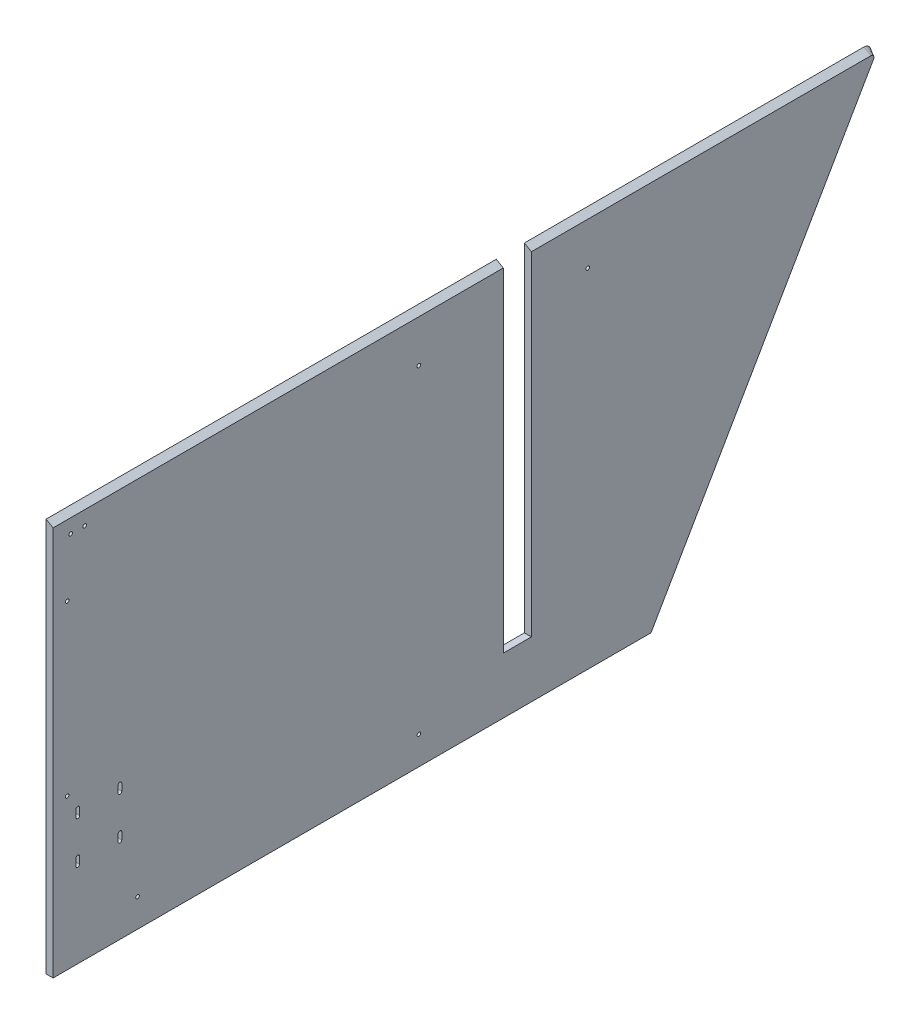
from build123d import *
from OCP.BRepFilletAPI import BRepFilletAPI_MakeChamfer

# Parameters (mm, degrees)
BOSS_EXTRUDE1_DEPTH                            = 6.35
SKETCH2_W                                      = 25.4
SKETCH2_H                                      = 304.8
CUT_EXTRUDE1_DEPTH                             = 672.86027017
FILLET1_R                                      = 6.35
CHAMFER3_SIZE                                  = 3.666174209
CHAMFER3_SIZE_2                                = 6.35
CSK_FOR_4_FLAT_HEAD_MACHINE_SCREW1_D           = 3.2639
CSK_FOR_4_FLAT_HEAD_MACHINE_SCREW1_CSINK_D     = 5.715
CSK_FOR_4_FLAT_HEAD_MACHINE_SCREW1_CSINK_ANGLE = 82
CUT_EXTRUDE2_REACH                             = 669.791
CSK_FOR_4_FLAT_HEAD_MACHINE_SCREW2_D           = 3.2639
CSK_FOR_4_FLAT_HEAD_MACHINE_SCREW2_CSINK_D     = 5.715
CSK_FOR_4_FLAT_HEAD_MACHINE_SCREW2_CSINK_ANGLE = 82


with BuildPart() as part:
    # Sketch1 → Boss-Extrude1 (new body)
    with BuildSketch(Plane(origin=(0, 0, 0), x_dir=(0, 0, -1), z_dir=(1, 0, 0))):
        Polygon((588.635764647, 323.826862244), (383.330008924, -31.773137756), (-160.664235353, -31.773137756), (-160.664235353, 323.826862244), align=None)
    extrude(amount=BOSS_EXTRUDE1_DEPTH)

    # Sketch2 → Cut-Extrude1 (cut, through all)
    with BuildSketch(Plane.ZY):
        with Locations((-258.435764647, 171.426862244)):
            Rectangle(SKETCH2_W, SKETCH2_H)
    extrude(amount=-CUT_EXTRUDE1_DEPTH, mode=Mode.SUBTRACT)

    # Fillet1
    fillet1_edges = [part.edges().sort_by_distance(p)[0] for p in [
        (3.175, 323.826862244, -588.635764647),
    ]]
    fillet(fillet1_edges, radius=FILLET1_R)

    # Chamfer3
    chamfer3_edges_1 = [part.edges().sort_by_distance(p)[0] for p in [
        (6.35, 323.826862244, -42.535764647),
    ]]
    chamfer3_side_1 = [part.faces().sort_by_distance(p)[0] for p in [
        (6.35, 323.753538759, -42.535764647),
    ]]
    chamfer3_edges_2 = [part.edges().sort_by_distance(p)[0] for p in [
        (6.35, 141.264362244, -483.233256128),
    ]]
    chamfer3_side_2 = [part.faces().sort_by_distance(p)[0] for p in [
        (6.276676516, 141.264362244, -483.233256128),
    ]]
    chamfer3_edges_3 = [part.edges().sort_by_distance(p)[0] for p in [
        (6.35, 320.651862244, -583.136503333),
    ]]
    chamfer3_side_3 = [part.faces().sort_by_distance(p)[0] for p in [
        (6.276676516, 320.651862244, -583.136503333),
    ]]
    chamfer3_edges_4 = [part.edges().sort_by_distance(p)[0] for p in [
        (6.35, 323.826862244, -424.386503333),
    ]]
    chamfer3_side_4 = [part.faces().sort_by_distance(p)[0] for p in [
        (6.35, 323.753538759, -424.386503333),
    ]]
    chamfer3 = BRepFilletAPI_MakeChamfer(part.part.solid().wrapped)
    for e in chamfer3_edges_1:
        chamfer3.Add(CHAMFER3_SIZE - 0.0001, CHAMFER3_SIZE_2 - 0.0001, e.wrapped, chamfer3_side_1[0].wrapped)
    for e in chamfer3_edges_2:
        chamfer3.Add(CHAMFER3_SIZE_2 - 0.0001, CHAMFER3_SIZE - 0.0001, e.wrapped, chamfer3_side_2[0].wrapped)
    for e in chamfer3_edges_3:
        chamfer3.Add(CHAMFER3_SIZE_2 - 0.0001, CHAMFER3_SIZE - 0.0001, e.wrapped, chamfer3_side_3[0].wrapped)
    for e in chamfer3_edges_4:
        chamfer3.Add(CHAMFER3_SIZE - 0.0001, CHAMFER3_SIZE_2 - 0.0001, e.wrapped, chamfer3_side_4[0].wrapped)
    add(Compound.cast(chamfer3.Shape()), mode=Mode.REPLACE)  # a hair under: the kernel refuses the full size

    # CSK for #4 Flat Head Machine Screw1 (through all)
    with Locations(Plane(origin=(0, 256.516862244, 147.964235353), x_dir=(0, 0, -1), z_dir=(-1, 0, 0))):
        with Locations((0, 0), (317.5, -25.4), (469.9, -25.4), (0, 152.4), (63.5, 262.89), (317.5, 262.89)):
            CounterSinkHole(CSK_FOR_4_FLAT_HEAD_MACHINE_SCREW1_D / 2, CSK_FOR_4_FLAT_HEAD_MACHINE_SCREW1_CSINK_D / 2, counter_sink_angle=CSK_FOR_4_FLAT_HEAD_MACHINE_SCREW1_CSINK_ANGLE)

    # Sketch7 → Cut-Extrude2 (cut, up to next)
    with BuildSketch(Plane.ZY, mode=Mode.PRIVATE) as cut_extrude2_sk1:
        with BuildLine():
            Line((140.071185353, 89.635966927), (140.071185353, 83.285966927))
            ThreePointArc((140.071185353, 83.285966927), (138.439235353, 81.654016927), (136.807285353, 83.285966927))
            Line((136.807285353, 83.285966927), (136.807285353, 89.635966927))
            ThreePointArc((136.807285353, 89.635966927), (138.439235353, 91.267916927), (140.071185353, 89.635966927))
        make_face()
    cut_extrude2_tool1 = extrude(cut_extrude2_sk1.sketch, amount=-CUT_EXTRUDE2_REACH, mode=Mode.PRIVATE) & part.part
    # Sketch7 → Cut-Extrude2 (cut, up to next)
    with BuildSketch(Plane.ZY, mode=Mode.PRIVATE) as cut_extrude2_sk2:
        with BuildLine():
            Line((98.707285353, 83.285966927), (98.707285353, 89.635966927))
            ThreePointArc((98.707285353, 89.635966927), (100.339235353, 91.267916927), (101.971185353, 89.635966927))
            Line((101.971185353, 89.635966927), (101.971185353, 83.285966927))
            ThreePointArc((101.971185353, 83.285966927), (100.339235353, 81.654016927), (98.707285353, 83.285966927))
        make_face()
    cut_extrude2_tool2 = extrude(cut_extrude2_sk2.sketch, amount=-CUT_EXTRUDE2_REACH, mode=Mode.PRIVATE) & part.part
    # Sketch7 → Cut-Extrude2 (cut, up to next)
    with BuildSketch(Plane.ZY, mode=Mode.PRIVATE) as cut_extrude2_sk3:
        with BuildLine():
            Line((98.707285353, 45.185966927), (98.707285353, 51.535966927))
            ThreePointArc((98.707285353, 51.535966927), (100.339235353, 53.167916927), (101.971185353, 51.535966927))
            Line((101.971185353, 51.535966927), (101.971185353, 45.185966927))
            ThreePointArc((101.971185353, 45.185966927), (100.339235353, 43.554016927), (98.707285353, 45.185966927))
        make_face()
    cut_extrude2_tool3 = extrude(cut_extrude2_sk3.sketch, amount=-CUT_EXTRUDE2_REACH, mode=Mode.PRIVATE) & part.part
    # Sketch7 → Cut-Extrude2 (cut, up to next)
    with BuildSketch(Plane.ZY, mode=Mode.PRIVATE) as cut_extrude2_sk4:
        with BuildLine():
            Line((136.807285353, 45.185966927), (136.807285353, 51.535966927))
            ThreePointArc((136.807285353, 51.535966927), (138.439235353, 53.167916927), (140.071185353, 51.535966927))
            Line((140.071185353, 51.535966927), (140.071185353, 45.185966927))
            ThreePointArc((140.071185353, 45.185966927), (138.439235353, 43.554016927), (136.807285353, 45.185966927))
        make_face()
    cut_extrude2_tool4 = extrude(cut_extrude2_sk4.sketch, amount=-CUT_EXTRUDE2_REACH, mode=Mode.PRIVATE) & part.part
    add(cut_extrude2_tool1.solids().sort_by_distance((0, 86.460967, 138.439235))[0], mode=Mode.SUBTRACT)
    add(cut_extrude2_tool2.solids().sort_by_distance((0, 86.460967, 100.339235))[0], mode=Mode.SUBTRACT)
    add(cut_extrude2_tool3.solids().sort_by_distance((0, 48.360967, 100.339235))[0], mode=Mode.SUBTRACT)
    add(cut_extrude2_tool4.solids().sort_by_distance((0, 48.360967, 138.439235))[0], mode=Mode.SUBTRACT)

    # CSK for #4 Flat Head Machine Screw2 (through all)
    with Locations(Plane.ZY):
        with Locations((132.089235353, 307.460688034), (144.789235353, 307.460688034)):
            CounterSinkHole(CSK_FOR_4_FLAT_HEAD_MACHINE_SCREW2_D / 2, CSK_FOR_4_FLAT_HEAD_MACHINE_SCREW2_CSINK_D / 2, counter_sink_angle=CSK_FOR_4_FLAT_HEAD_MACHINE_SCREW2_CSINK_ANGLE)


solid = part.part
